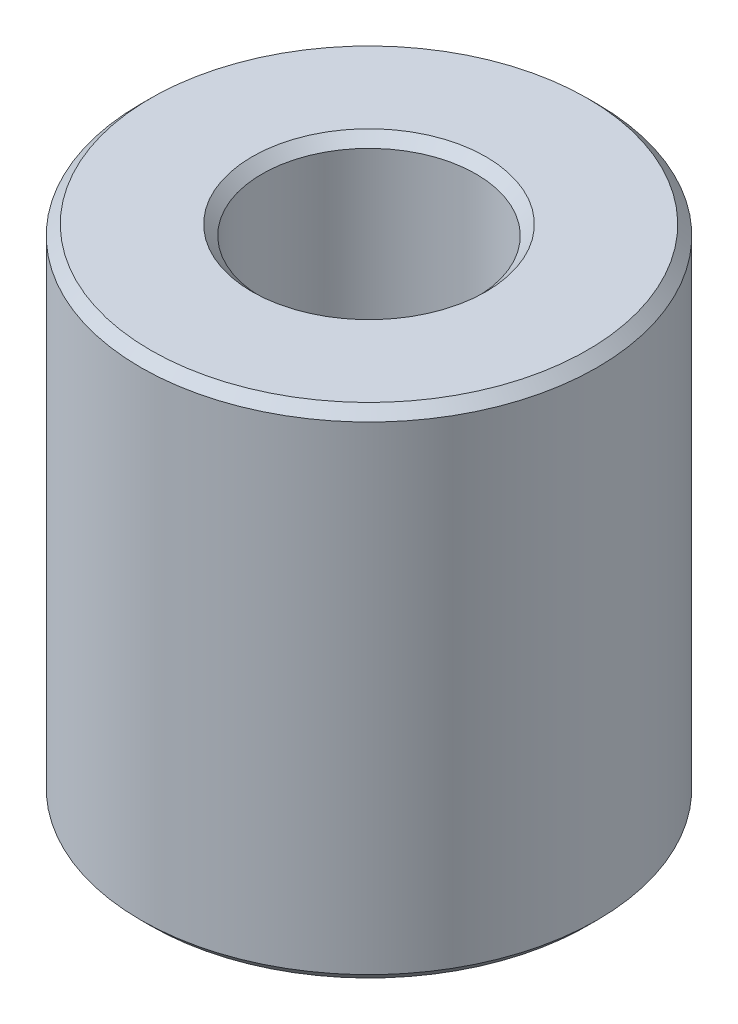
from build123d import *

# Parameters (mm, degrees)
SKETCH1_R           = 5
BOSS_EXTRUDE1_DEPTH = 10.918688723
SKETCH2_R           = 2.343802209
CUT_EXTRUDE1_DEPTH  = 14.00837282
CHAMFER1_SIZE       = 0.217821556


with BuildPart() as part:
    # Sketch1 → Boss-Extrude1 (new body)
    with BuildSketch(Plane(origin=(0, 0, 0), x_dir=(1, 0, 0), z_dir=(0, 1, 0))):
        Circle(SKETCH1_R)
    extrude(amount=BOSS_EXTRUDE1_DEPTH)

    # Sketch2 → Cut-Extrude1 (cut, through all)
    with BuildSketch(Plane(origin=(0, 0, 0), x_dir=(1, 0, 0), z_dir=(0, 1, 0))):
        Circle(SKETCH2_R)
    extrude(amount=CUT_EXTRUDE1_DEPTH, mode=Mode.SUBTRACT)

    # Chamfer1
    chamfer1_edges = [part.edges().sort_by_distance(p)[0] for p in [
        (-2.343802209, 10.918688723, 0),
        (-2.343802209, 0, 0),
        (-5, 0, 0),
        (-5, 10.918688723, 0),
    ]]
    chamfer(chamfer1_edges, length=CHAMFER1_SIZE)


solid = part.part
